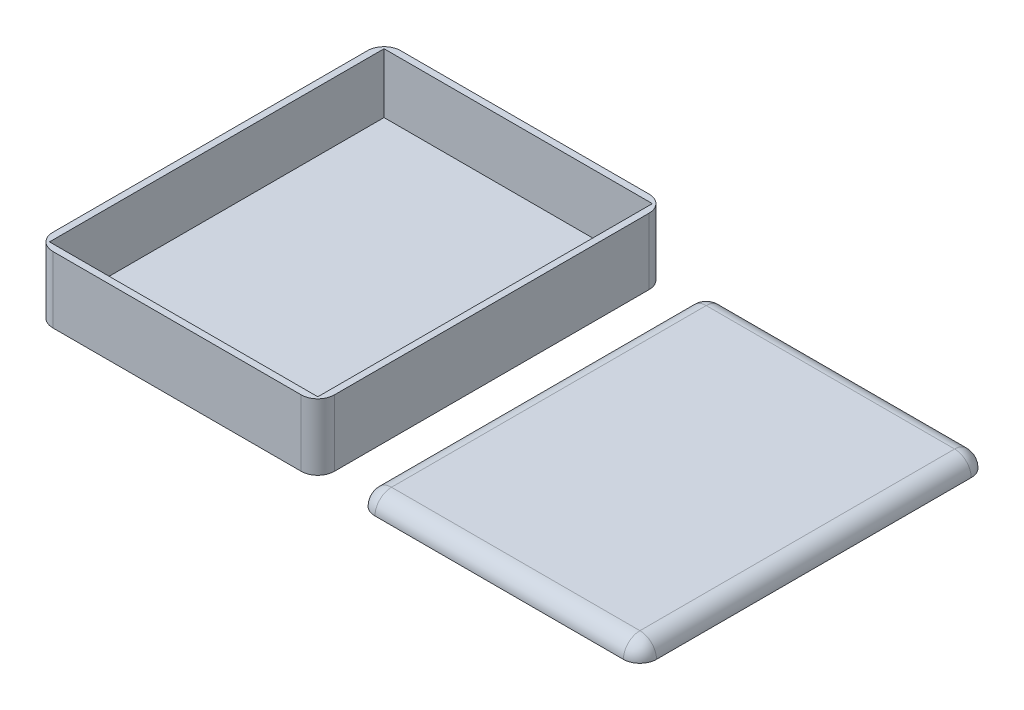
from build123d import *

# Parameters (mm, degrees)
SKETCH1_W           = 85
SKETCH1_H           = 105
BOSS_EXTRUDE1_DEPTH = 20
SHELL1_T            = -2
SKETCH2_W           = 85
SKETCH2_H           = 105
BOSS_EXTRUDE2_DEPTH = 5
FILLET1_R           = 5
FILLET2_R           = 5
FILLET3_R           = 5


with BuildPart() as part:
    # Sketch1 → Boss-Extrude1 (new body)
    with BuildSketch(Plane(origin=(0, 0, 0), x_dir=(1, 0, 0), z_dir=(0, 1, 0))):
        Rectangle(SKETCH1_W, SKETCH1_H)
    extrude(amount=BOSS_EXTRUDE1_DEPTH)

    # Shell1
    shell1_openings = [part.faces().sort_by_distance(p)[0] for p in [
        (0, 20, 0),
    ]]
    offset(amount=SHELL1_T, openings=shell1_openings, kind=Kind.INTERSECTION)

    # Fillet1
    fillet1_edges = [part.edges().sort_by_distance(p)[0] for p in [
        (42.5, 10, 52.5),
        (-42.5, 10, 52.5),
        (-42.5, 10, -52.5),
        (42.5, 10, -52.5),
    ]]
    fillet(fillet1_edges, radius=FILLET1_R)


with BuildPart() as body_2:
    # Sketch2 → Boss-Extrude2 (new body)
    with BuildSketch(Plane(origin=(11.543615237, 0, 0), x_dir=(1, 0, 0), z_dir=(0, 1, 0))):
        with Locations((86.236548959, -0.529735839)):
            Rectangle(SKETCH2_W, SKETCH2_H)
    extrude(amount=BOSS_EXTRUDE2_DEPTH)

    # Fillet2
    fillet2_edges = [body_2.edges().sort_by_distance(p)[0] for p in [
        (55.280164195, 2.5, -51.970264161),
        (140.280164195, 2.5, -51.970264161),
        (140.280164195, 2.5, 53.029735839),
        (55.280164195, 2.5, 53.029735839),
    ]]
    fillet(fillet2_edges, radius=FILLET2_R)

    # Fillet3
    fillet3_edges = [body_2.edges().sort_by_distance(p)[0] for p in [
        (56.744630289, 5, 51.565269745),
        (55.280164195, 5, 0.529735839),
        (56.744630289, 5, -50.505798067),
        (97.780164195, 5, -51.970264161),
        (138.815698101, 5, -50.505798067),
        (140.280164195, 5, 0.529735839),
        (138.815698101, 5, 51.565269745),
        (97.780164195, 5, 53.029735839),
    ]]
    fillet(fillet3_edges, radius=FILLET3_R - 0.0001)  # a hair under: the kernel refuses the full size


solid = Compound([part.part, body_2.part])
